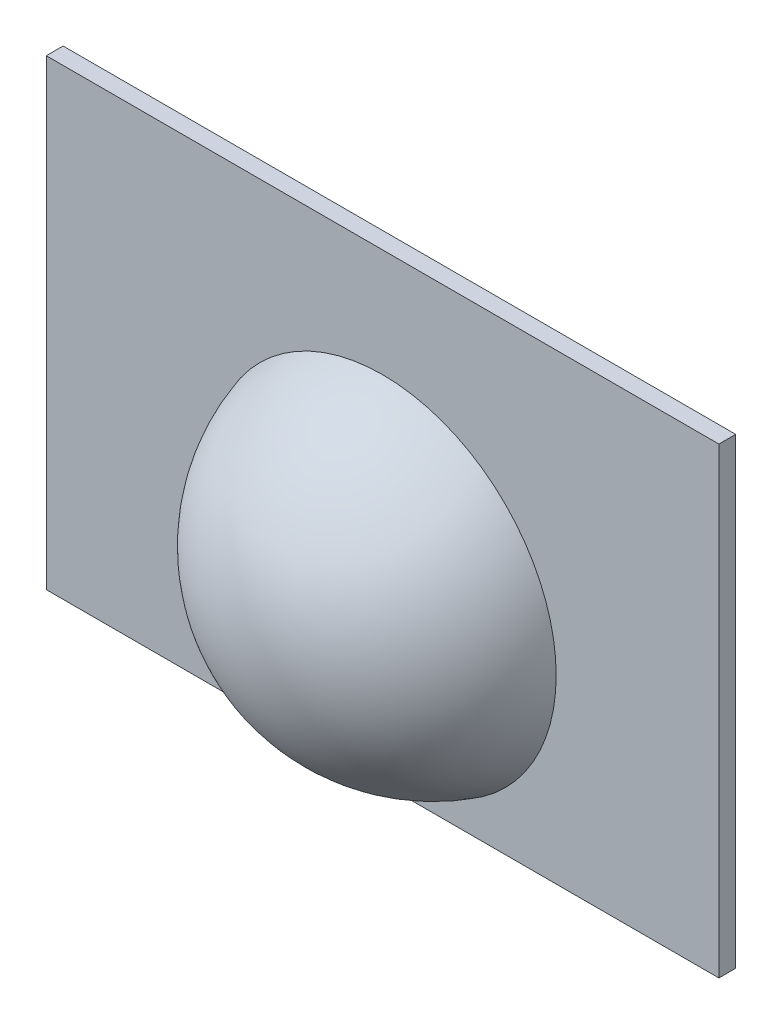
from build123d import *

# Parameters (mm, degrees)
SKETCH2_W           = 80
SKETCH2_H           = 55
BOSS_EXTRUDE1_DEPTH = 2
SKETCH3_W           = 80
SKETCH3_H           = 55
CUT_EXTRUDE2_DEPTH  = 59.073229633


with BuildPart() as part:
    # Sketch1 → Revolve1 (revolve)
    with BuildSketch(Plane.XY):
        with BuildLine():
            Line((0, 21.5), (0, -21.5))
            ThreePointArc((0, -21.5), (21.5, 0), (0, 21.5))
        make_face()
    revolve(axis=Axis((0, 21.5, 0), (0, -1, 0)))

    # Sketch2 → Boss-Extrude1 (add)
    with BuildSketch(Plane.XY.offset(6)):
        with Locations((0, 6)):
            Rectangle(SKETCH2_W, SKETCH2_H)
    extrude(amount=-BOSS_EXTRUDE1_DEPTH)

    # Sketch3 → Cut-Extrude2 (cut, through all)
    with BuildSketch(Plane.XY.offset(4)):
        with Locations((0, 6)):
            Rectangle(SKETCH3_W, SKETCH3_H)
    extrude(amount=-CUT_EXTRUDE2_DEPTH, mode=Mode.SUBTRACT)


solid = part.part
